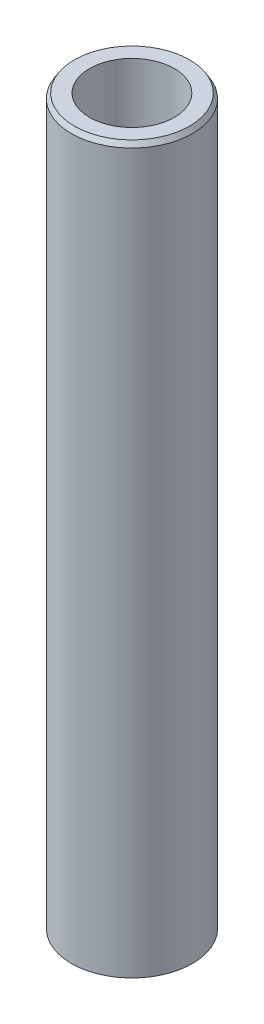
from build123d import *
from OCP.BRepFilletAPI import BRepFilletAPI_MakeChamfer

# Parameters (mm, degrees)
SKETCH1_R           = 50
BOSS_EXTRUDE1_DEPTH = 600
SKETCH2_R           = 34.981837083
CUT_EXTRUDE1_DEPTH  = 605.15229868
CHAMFER1_SIZE       = 4.060019163
CHAMFER1_SIZE2      = 2.5067256


with BuildPart() as part:
    # Sketch1 → Boss-Extrude1 (new body)
    with BuildSketch(Plane(origin=(0, 0, 0), x_dir=(1, 0, 0), z_dir=(0, 1, 0))):
        Circle(SKETCH1_R)
    extrude(amount=BOSS_EXTRUDE1_DEPTH)

    # Sketch2 → Cut-Extrude1 (cut, through all)
    with BuildSketch(Plane(origin=(0, 0, 0), x_dir=(1, 0, 0), z_dir=(0, 1, 0))):
        Circle(SKETCH2_R)
    extrude(amount=CUT_EXTRUDE1_DEPTH, mode=Mode.SUBTRACT)

    # Chamfer1: one chamfer whose edges measure the first distance from different faces: ONE call of the kernel's chamfer builder (chamfer() names one face for all edges)
    chamfer1_edges_1 = [part.edges().sort_by_distance(p)[0] for p in [
        (-50, 600, 0),
    ]]
    chamfer1_side_1 = [part.faces().sort_by_distance(p)[0] for p in [
        (-50, 300, 0),
    ]]
    chamfer1_edges_2 = [part.edges().sort_by_distance(p)[0] for p in [
        (-50, 0, 0),
    ]]
    chamfer1_side_2 = [part.faces().sort_by_distance(p)[0] for p in [
        (-48.585786438, 0, 0),
    ]]
    chamfer1 = BRepFilletAPI_MakeChamfer(part.part.solid().wrapped)
    for e in chamfer1_edges_1:
        chamfer1.Add(CHAMFER1_SIZE, CHAMFER1_SIZE2, e.wrapped, chamfer1_side_1[0].wrapped)  # the first distance lies on this face
    for e in chamfer1_edges_2:
        chamfer1.Add(CHAMFER1_SIZE, CHAMFER1_SIZE2, e.wrapped, chamfer1_side_2[0].wrapped)  # the first distance lies on this face
    add(Compound.cast(chamfer1.Shape()), mode=Mode.REPLACE)


solid = part.part
